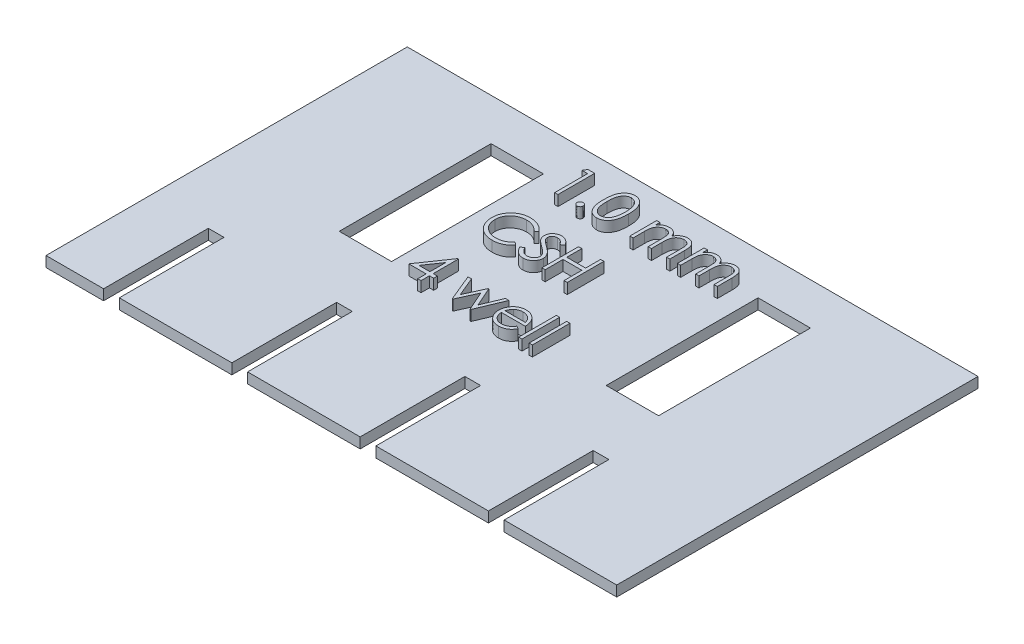
from build123d import *

# Parameters (mm, degrees)
SKETCH1_W           = 54.5
SKETCH1_H           = 34.5
BOSS_EXTRUDE1_DEPTH = 1
SKETCH6_W           = 5
SKETCH6_H           = 14.5
CUT_EXTRUDE1_DEPTH  = 2
SKETCH9_W           = 5
SKETCH9_H           = 14.5
CUT_EXTRUDE2_DEPTH  = 2
SKETCH27_W          = 1.5
SKETCH27_H          = 10
CUT_EXTRUDE3_DEPTH  = 2
WRAP1_OUTLINE_W     = 0.314102564
WRAP1_OUTLINE_H     = 3.58974359
WRAP1_DEPTH         = 1
SKETCH37_W          = 1.5
SKETCH37_H          = 10
CUT_EXTRUDE10_DEPTH = 2
SKETCH39_W          = 1.5
SKETCH39_H          = 10
CUT_EXTRUDE11_DEPTH = 2
SKETCH41_W          = 1.5
SKETCH41_H          = 10
CUT_EXTRUDE12_DEPTH = 2


# Read off the part's stored shape, not the designer's step: Wrap1
with BuildPart() as part:
    # Sketch1 → Boss-Extrude1 (new body)
    with BuildSketch(Plane(origin=(0, 0, 0), x_dir=(1, 0, 0), z_dir=(0, 1, 0))):
        Rectangle(SKETCH1_W, SKETCH1_H)
    extrude(amount=BOSS_EXTRUDE1_DEPTH)

    # Sketch6 → Cut-Extrude1 (cut)
    with BuildSketch(Plane(origin=(0, 1, 0), x_dir=(1, 0, 0), z_dir=(0, 1, 0))):
        with Locations((-12.75, 6)):
            Rectangle(SKETCH6_W, SKETCH6_H)
    extrude(amount=-CUT_EXTRUDE1_DEPTH, mode=Mode.SUBTRACT)

    # Sketch9 → Cut-Extrude2 (cut)
    with BuildSketch(Plane(origin=(0, 1, 0), x_dir=(1, 0, 0), z_dir=(0, 1, 0))):
        with Locations((12.75, 6)):
            Rectangle(SKETCH9_W, SKETCH9_H)
    extrude(amount=-CUT_EXTRUDE2_DEPTH, mode=Mode.SUBTRACT)

    # Sketch27 → Cut-Extrude3 (cut)
    with BuildSketch(Plane(origin=(0, 1, 0), x_dir=(1, 0, 0), z_dir=(0, 1, 0))):
        with Locations((-21, -12.25)):
            Rectangle(SKETCH27_W, SKETCH27_H)
    extrude(amount=-CUT_EXTRUDE3_DEPTH, mode=Mode.SUBTRACT)

    # Wrap1 outline → Wrap1 (add)
    # profile 1 of 13: a face of its own
    with BuildSketch(Plane(origin=(0, 1, 0), x_dir=(1, 0, 0), z_dir=(0, 1, 0))):
        with BuildLine():
            add(Edge.make_bspline(
                [(-4.694666055, 11.487214304), (-4.695861656, 11.467970974), (-4.698219363, 11.43002341), (-4.713481971, 11.374741948), (-4.742380021, 11.325115043), (-4.778615014, 11.279812905), (-4.823411448, 11.242872034), (-4.873513294, 11.21544869), (-4.928504552, 11.19875671), (-4.966820876, 11.196630413), (-4.986332722, 11.195547637)],
                knots=[0, 0, 0, 0, 0.126177718, 0.248820607, 0.371539969, 0.499983707, 0.627244198, 0.749225521, 0.87229795, 1, 1, 1, 1], degree=3))
            add(Edge.make_bspline(
                [(-4.986332722, 11.77888097), (-4.96684251, 11.777722804), (-4.928634227, 11.775452353), (-4.873395099, 11.759875679), (-4.823400439, 11.732217019), (-4.778868194, 11.695354241), (-4.742161718, 11.650658577), (-4.713517366, 11.601062669), (-4.698076381, 11.545361076), (-4.695822469, 11.506931401), (-4.694666055, 11.487214304)],
                knots=[0, 0, 0, 0, 0.127518927, 0.249985948, 0.371792352, 0.498870353, 0.625948354, 0.748491738, 0.870958759, 1, 1, 1, 1], degree=3))
            add(Edge.make_bspline(
                [(-5.277999388, 11.487214304), (-5.276937289, 11.506963683), (-5.274863671, 11.545521923), (-5.258088011, 11.600721031), (-5.230711799, 11.65088947), (-5.193706404, 11.69528605), (-5.149182108, 11.732473353), (-5.098885903, 11.759538146), (-5.043846362, 11.775578558), (-5.005836424, 11.777761075), (-4.986332722, 11.77888097)],
                knots=[0, 0, 0, 0, 0.129096958, 0.252045967, 0.373904964, 0.501037835, 0.628170706, 0.751376463, 0.872426013, 1, 1, 1, 1], degree=3))
            add(Edge.make_bspline(
                [(-4.986332722, 11.195547637), (-5.005858627, 11.196591234), (-5.04397831, 11.198628609), (-5.098764304, 11.215791415), (-5.149171273, 11.242614876), (-5.193958985, 11.279881785), (-5.230497456, 11.324881929), (-5.258122839, 11.375083725), (-5.274712988, 11.429865162), (-5.276894861, 11.467939805), (-5.277999388, 11.487214304)],
                knots=[0, 0, 0, 0, 0.127756603, 0.249414355, 0.372796476, 0.500111333, 0.628609941, 0.750643374, 0.873768379, 1, 1, 1, 1], degree=3))
        make_face()
    # profile 2 of 13: a face of its own
    with BuildSketch(Plane(origin=(0, 1, 0), x_dir=(1, 0, 0), z_dir=(0, 1, 0))):
        with BuildLine():
            add(Edge.make_bspline(
                [(-3.075775831, 14.830163022), (-3.047940352, 14.829675206), (-2.992584343, 14.828705095), (-2.910743968, 14.819381153), (-2.830794286, 14.80391003), (-2.753076148, 14.781989055), (-2.676951161, 14.754793379), (-2.603014754, 14.720706261), (-2.530807672, 14.681027394), (-2.461477384, 14.634403517), (-2.394262769, 14.582421241), (-2.330814806, 14.523658572), (-2.27112772, 14.458708853), (-2.214452415, 14.388266989), (-2.162396818, 14.310981904), (-2.112823385, 14.228197794), (-2.06845135, 14.138466929), (-2.025716674, 14.043286461), (-1.988829688, 13.940022803), (-1.955563442, 13.829258042), (-1.928684474, 13.709683855), (-1.906295201, 13.58192761), (-1.888950305, 13.445520127), (-1.876317663, 13.300753811), (-1.869644578, 13.147533421), (-1.868387877, 13.042775571), (-1.867742978, 12.989017188)],
                knots=[0, 0, 0, 0, 0.033788116, 0.067193932, 0.099862411, 0.132566612, 0.165151173, 0.197913187, 0.231319004, 0.265083278, 0.299255309, 0.334398567, 0.369942824, 0.406283561, 0.44406382, 0.482997707, 0.523354447, 0.56553659, 0.609612924, 0.656390811, 0.705885495, 0.7583245, 0.813831783, 0.872794559, 0.93472223, 1, 1, 1, 1], degree=3))
            add(Edge.make_bspline(
                [(-4.245948106, 12.989017188), (-4.245620088, 13.045114576), (-4.244982908, 13.15408456), (-4.237894487, 13.312869202), (-4.226119145, 13.461829491), (-4.209981772, 13.600972557), (-4.190343792, 13.730334322), (-4.164128305, 13.849569079), (-4.134315503, 13.959228686), (-4.099763057, 14.059670734), (-4.060775268, 14.152248437), (-4.018341007, 14.238673638), (-3.970776213, 14.318815571), (-3.9207993, 14.393953361), (-3.866387228, 14.462857056), (-3.809088438, 14.526499718), (-3.746666561, 14.583410469), (-3.681243553, 14.635256771), (-3.612227089, 14.680706243), (-3.541584423, 14.720738982), (-3.468829317, 14.754938849), (-3.393763134, 14.781829285), (-3.317060576, 14.804040131), (-3.238453509, 14.819229079), (-3.157812145, 14.828785988), (-3.103380711, 14.829699655), (-3.075775831, 14.830163022)],
                knots=[0, 0, 0, 0, 0.068594622, 0.133246042, 0.194312586, 0.251279223, 0.304513439, 0.354234907, 0.400480589, 0.443410755, 0.484014869, 0.523252301, 0.561042373, 0.597900239, 0.633518489, 0.668314351, 0.702495671, 0.736685354, 0.770293169, 0.803437255, 0.835912952, 0.868460246, 0.900846538, 0.933466525, 0.966257575, 1, 1, 1, 1], degree=3))
            add(Edge.make_bspline(
                [(-3.075775831, 11.150675842), (-3.103379945, 11.151142198), (-3.15780987, 11.152061759), (-3.238462295, 11.161575491), (-3.316744738, 11.176870994), (-3.393043492, 11.198287598), (-3.467750008, 11.224502435), (-3.539846294, 11.258656118), (-3.610133978, 11.297990187), (-3.678425534, 11.342785609), (-3.743437695, 11.394107292), (-3.8055363, 11.45087158), (-3.863161319, 11.514494992), (-3.916795415, 11.583972915), (-3.967769503, 11.658666157), (-4.014658876, 11.73959453), (-4.058029731, 11.826437141), (-4.097673221, 11.919755051), (-4.132821885, 12.020909979), (-4.163869593, 12.131059158), (-4.18838375, 12.251174794), (-4.209366706, 12.380292161), (-4.226291089, 12.518966091), (-4.237845414, 12.667271869), (-4.244986729, 12.825117078), (-4.245621799, 12.933386853), (-4.245948106, 12.989017188)],
                knots=[0, 0, 0, 0, 0.033787146, 0.066621658, 0.099284878, 0.131361165, 0.163585188, 0.196103927, 0.228902254, 0.262158056, 0.295991222, 0.330217846, 0.365059826, 0.400950737, 0.437620382, 0.475707529, 0.515380692, 0.556413541, 0.59976483, 0.646424156, 0.696431445, 0.749781518, 0.806573307, 0.867435532, 0.931886753, 1, 1, 1, 1], degree=3))
            add(Edge.make_bspline(
                [(-1.867742978, 12.989017188), (-1.868394563, 12.93549328), (-1.869664149, 12.831204128), (-1.876242855, 12.678673153), (-1.889201487, 12.53467511), (-1.905411475, 12.398864647), (-1.927862438, 12.271807029), (-1.955467604, 12.15306258), (-1.986117927, 12.042118508), (-2.023952721, 11.939883697), (-2.065363431, 11.844931974), (-2.110418628, 11.756264826), (-2.158688454, 11.673098533), (-2.211277199, 11.596098786), (-2.267330612, 11.524720129), (-2.328048401, 11.460222506), (-2.391718986, 11.401051834), (-2.459131402, 11.348400207), (-2.529542953, 11.302315402), (-2.60150203, 11.261101552), (-2.676285413, 11.227868857), (-2.752198366, 11.199333816), (-2.830326732, 11.177533364), (-2.910573123, 11.162459508), (-2.992529359, 11.15188766), (-3.047930924, 11.15108118), (-3.075775831, 11.150675842)],
                knots=[0, 0, 0, 0, 0.06506329, 0.126773166, 0.185515763, 0.240764679, 0.292979796, 0.342250373, 0.388919286, 0.432775664, 0.474628433, 0.514774691, 0.553605893, 0.591426406, 0.62802812, 0.663803634, 0.698984336, 0.733591489, 0.767628469, 0.801208348, 0.83426384, 0.866980695, 0.899719742, 0.932701912, 0.966175883, 1, 1, 1, 1], degree=3))
        make_face()
        with BuildLine():
            add(Edge.make_bspline(
                [(-3.065259004, 11.509650201), (-3.026501332, 11.511247982), (-2.949066009, 11.514440245), (-2.835932214, 11.545238982), (-2.726101944, 11.591708521), (-2.640030004, 11.646656027), (-2.57454746, 11.698984356), (-2.52763047, 11.743599005), (-2.484568421, 11.793554872), (-2.443726347, 11.847454168), (-2.406267271, 11.906326652), (-2.372204133, 11.969889227), (-2.341120786, 12.038318405), (-2.32341174, 12.086088144), (-2.314357562, 12.110511579)],
                knots=[0, 0, 0, 0, 0.112813401, 0.225393884, 0.339594815, 0.45967541, 0.52173519, 0.583925839, 0.648174145, 0.713881038, 0.781004455, 0.851450928, 0.924050693, 1, 1, 1, 1], degree=3))
            add(Edge.make_bspline(
                [(-3.931845542, 12.990419432), (-3.931726095, 12.943670733), (-3.931494272, 12.852940688), (-3.925438071, 12.721097427), (-3.917187839, 12.598127098), (-3.906546542, 12.483873562), (-3.890743594, 12.378723549), (-3.873036806, 12.281953866), (-3.851488716, 12.194076629), (-3.825993698, 12.114488819), (-3.796954601, 12.04183975), (-3.765248738, 11.974238535), (-3.731188015, 11.910886598), (-3.693068864, 11.85235299), (-3.651553801, 11.798446826), (-3.607580542, 11.748213994), (-3.559507958, 11.703417012), (-3.493004215, 11.649690157), (-3.405207741, 11.594171024), (-3.294587286, 11.545824934), (-3.180918835, 11.515442477), (-3.103767584, 11.511578721), (-3.065259004, 11.509650201)],
                knots=[0, 0, 0, 0, 0.072951066, 0.141583694, 0.20592646, 0.265301357, 0.320597233, 0.371816503, 0.41878977, 0.461698729, 0.502133582, 0.540804315, 0.578180525, 0.614296865, 0.649678243, 0.68429946, 0.718358953, 0.752080865, 0.817652439, 0.879722076, 0.93996556, 1, 1, 1, 1], degree=3))
            add(Edge.make_bspline(
                [(-3.065259004, 14.471188663), (-3.103969596, 14.469157216), (-3.181461302, 14.465090622), (-3.295909256, 14.436397368), (-3.405613608, 14.386384402), (-3.492856583, 14.33143203), (-3.559720369, 14.279093718), (-3.606803062, 14.233707264), (-3.650949235, 14.18406101), (-3.691616935, 14.129659095), (-3.729706218, 14.071193728), (-3.764687231, 14.008204963), (-3.79620456, 13.940373599), (-3.825289096, 13.867757163), (-3.850861884, 13.788176219), (-3.871955848, 13.700407225), (-3.891442901, 13.603945334), (-3.90523817, 13.498225826), (-3.917501926, 13.383943672), (-3.925383273, 13.260666354), (-3.931514531, 13.128601974), (-3.931732995, 13.037402815), (-3.931845542, 12.990419432)],
                knots=[0, 0, 0, 0, 0.060386619, 0.120883249, 0.182754619, 0.24781103, 0.2812991, 0.315087624, 0.349702396, 0.384856581, 0.420966197, 0.458511188, 0.497174722, 0.537602048, 0.580503018, 0.62746754, 0.67838821, 0.733983221, 0.793746705, 0.857713672, 0.926697864, 1, 1, 1, 1], degree=3))
            add(Edge.make_bspline(
                [(-2.181845542, 12.990419432), (-2.182395732, 13.032487004), (-2.183472019, 13.114780169), (-2.187586007, 13.23529835), (-2.198209582, 13.349766111), (-2.2100087, 13.458676583), (-2.227405921, 13.561426886), (-2.246163728, 13.658877191), (-2.271364941, 13.749820216), (-2.298284716, 13.835679798), (-2.329095111, 13.915480452), (-2.363010845, 13.989594239), (-2.399232604, 14.058378963), (-2.438574845, 14.121645905), (-2.480570528, 14.179678448), (-2.526328077, 14.231313042), (-2.57403245, 14.278150011), (-2.640849636, 14.33161258), (-2.728323925, 14.386124275), (-2.837169573, 14.436290035), (-2.950440217, 14.465098328), (-3.027013671, 14.469160015), (-3.065259004, 14.471188663)],
                knots=[0, 0, 0, 0, 0.065681198, 0.128486464, 0.18817513, 0.245106131, 0.299448425, 0.350822936, 0.399941681, 0.446671744, 0.491254533, 0.533376344, 0.573852755, 0.612526312, 0.649597136, 0.685532042, 0.720105786, 0.753837663, 0.818925416, 0.880493462, 0.940311334, 1, 1, 1, 1], degree=3))
            add(Edge.make_bspline(
                [(-2.314357562, 12.110511579), (-2.303805794, 12.141741319), (-2.28238118, 12.205151083), (-2.254769406, 12.303514735), (-2.233024006, 12.406717499), (-2.213460641, 12.514142616), (-2.200107585, 12.626582317), (-2.189359772, 12.743688701), (-2.183029085, 12.865550063), (-2.182244334, 12.948345054), (-2.181845542, 12.990419432)],
                knots=[0, 0, 0, 0, 0.110588339, 0.224541754, 0.342503494, 0.464324098, 0.590756033, 0.722227475, 0.858842836, 1, 1, 1, 1], degree=3))
        make_face(mode=Mode.SUBTRACT)
    # profile 3 of 13: a face of its own
    with BuildSketch(Plane(origin=(0, 1, 0), x_dir=(1, 0, 0), z_dir=(0, 1, 0))):
        with BuildLine():
            add(Edge.make_bspline(
                [(0.33097497, 13.353600522), (0.35925892, 13.392488123), (0.41345368, 13.467000496), (0.502319333, 13.565190781), (0.591095445, 13.648518935), (0.655028827, 13.692261807), (0.685742599, 13.713276002)],
                knots=[0, 0, 0, 0, 0.283594808, 0.543394841, 0.780645629, 1, 1, 1, 1], degree=3))
            Line((0.33097497, 13.353600522), (0.33097497, 13.79811174))
            Line((0.33097497, 13.79811174), (0.016872406, 13.79811174))
            Line((0.016872406, 13.79811174), (0.016872406, 11.240419432))
            Line((0.016872406, 11.240419432), (0.33097497, 11.240419432))
            Line((0.33097497, 11.240419432), (0.33097497, 12.316641387))
            add(Edge.make_bspline(
                [(1.158298688, 13.52888097), (1.120282477, 13.52735051), (1.044517518, 13.524300358), (0.933215548, 13.496846084), (0.825729864, 13.453842009), (0.723775166, 13.39418219), (0.630101017, 13.320283111), (0.54809275, 13.233368216), (0.479150224, 13.134519182), (0.433418409, 13.042354666), (0.403919935, 12.960781391), (0.384324601, 12.891430443), (0.367484975, 12.814430195), (0.354970953, 12.729543084), (0.342890538, 12.63732199), (0.337060228, 12.5373075), (0.331388666, 12.429585412), (0.331116252, 12.355212867), (0.33097497, 12.316641387)],
                knots=[0, 0, 0, 0, 0.068677068, 0.136870959, 0.206114357, 0.277538182, 0.349771978, 0.421250836, 0.492910757, 0.567026589, 0.606614153, 0.649703954, 0.69730315, 0.74908566, 0.804880647, 0.865485006, 0.930237127, 1, 1, 1, 1], degree=3))
            add(Edge.make_bspline(
                [(1.766872406, 12.541000361), (1.766792975, 12.57769368), (1.766640158, 12.648287937), (1.763963841, 12.749521613), (1.758877219, 12.841602693), (1.752996671, 12.924424156), (1.744536492, 12.997835485), (1.73492673, 13.062230243), (1.72357812, 13.117446994), (1.704788235, 13.178010379), (1.676073767, 13.244731302), (1.629885505, 13.315872323), (1.572277924, 13.378140421), (1.504707049, 13.431299169), (1.428701366, 13.475240651), (1.344717966, 13.506900402), (1.253513053, 13.525324692), (1.190635347, 13.527673189), (1.158298688, 13.52888097)],
                knots=[0, 0, 0, 0, 0.082529704, 0.158778855, 0.227738062, 0.289945653, 0.345498839, 0.393896337, 0.436373785, 0.472122274, 0.536383616, 0.599077902, 0.661948234, 0.726310542, 0.791771103, 0.858647304, 0.927305334, 1, 1, 1, 1], degree=3))
            Line((1.766872406, 12.541000361), (1.766872406, 11.240419432))
            Line((1.766872406, 11.240419432), (2.08097497, 11.240419432))
            Line((2.08097497, 11.240419432), (2.08097497, 12.235311259))
            add(Edge.make_bspline(
                [(2.910402054, 13.52888097), (2.870732099, 13.527464813), (2.792329188, 13.524665948), (2.677883702, 13.496092075), (2.567912685, 13.453011824), (2.465697553, 13.390579367), (2.371669762, 13.315771003), (2.290770184, 13.226821407), (2.223937998, 13.12619148), (2.178684023, 13.033044778), (2.150094721, 12.949375334), (2.131217806, 12.876277962), (2.116534414, 12.793196394), (2.102763885, 12.700688903), (2.093776157, 12.598118723), (2.085607785, 12.485960322), (2.081786922, 12.363876363), (2.081252463, 12.279249674), (2.08097497, 12.235311259)],
                knots=[0, 0, 0, 0, 0.068158244, 0.134706602, 0.201864998, 0.270788266, 0.340024294, 0.408082739, 0.476813195, 0.547346064, 0.585639795, 0.628864953, 0.677153203, 0.730802811, 0.789806616, 0.854325009, 0.924365134, 1, 1, 1, 1], degree=3))
            add(Edge.make_bspline(
                [(3.516872406, 12.627238342), (3.516794523, 12.659958916), (3.516644844, 12.722842883), (3.513951213, 12.813095334), (3.508875899, 12.895363691), (3.50294126, 12.969535779), (3.49469745, 13.035784568), (3.484051519, 13.093976987), (3.472773839, 13.144570798), (3.454037848, 13.200656845), (3.424089956, 13.262527056), (3.378472476, 13.329250632), (3.32100237, 13.387331432), (3.254642213, 13.437749749), (3.179093768, 13.47874339), (3.095829045, 13.5080194), (3.005364994, 13.526142278), (2.942742205, 13.527948294), (2.910402054, 13.52888097)],
                knots=[0, 0, 0, 0, 0.078342985, 0.150563303, 0.216151057, 0.275679792, 0.32870705, 0.375904435, 0.417301898, 0.452692748, 0.517265292, 0.581216568, 0.645321894, 0.712024493, 0.780130045, 0.850218226, 0.922648522, 1, 1, 1, 1], degree=3))
            Line((3.516872406, 12.627238342), (3.516872406, 11.240419432))
            Line((3.516872406, 11.240419432), (3.83097497, 11.240419432))
            Line((3.83097497, 11.240419432), (3.83097497, 12.625836098))
            add(Edge.make_bspline(
                [(2.965089554, 13.842983534), (3.007971017, 13.841366314), (3.091894203, 13.838201255), (3.214071469, 13.813347782), (3.328013274, 13.770670135), (3.43349035, 13.712436498), (3.528650163, 13.639257315), (3.611366473, 13.552188477), (3.681136836, 13.451845854), (3.726715476, 13.357453866), (3.75763074, 13.274118533), (3.776691974, 13.203112241), (3.793531669, 13.124960689), (3.807512915, 13.039570427), (3.817731467, 12.946639819), (3.825302182, 12.846320943), (3.830426256, 12.738535831), (3.830788328, 12.664170331), (3.83097497, 12.625836098)],
                knots=[0, 0, 0, 0, 0.07560433, 0.147965015, 0.218796999, 0.289470445, 0.359724218, 0.429707739, 0.50049652, 0.57442902, 0.613947296, 0.65715527, 0.70397277, 0.754938985, 0.809706611, 0.868832954, 0.932385474, 1, 1, 1, 1], degree=3))
            add(Edge.make_bspline(
                [(2.026988592, 13.225295233), (2.040699844, 13.250019652), (2.067681661, 13.298673837), (2.112987298, 13.3675321), (2.160455094, 13.431938891), (2.210489587, 13.491945316), (2.262914174, 13.547255046), (2.317975575, 13.598050948), (2.375360356, 13.644551162), (2.455152596, 13.698874321), (2.558965203, 13.756575502), (2.689853318, 13.806603946), (2.82600349, 13.837520075), (2.918421188, 13.841150348), (2.965089554, 13.842983534)],
                knots=[0, 0, 0, 0, 0.071766064, 0.141225536, 0.209115852, 0.274839653, 0.33948293, 0.402476267, 0.464941889, 0.526832641, 0.647414816, 0.765561512, 0.881615087, 1, 1, 1, 1], degree=3))
            add(Edge.make_bspline(
                [(1.212986188, 13.842983534), (1.243879185, 13.841938244), (1.305014764, 13.839869669), (1.395598854, 13.826409634), (1.483457466, 13.803143461), (1.568071495, 13.770736137), (1.647792175, 13.73148945), (1.720881372, 13.685439742), (1.786505581, 13.633742667), (1.844631632, 13.574063734), (1.896900657, 13.504727135), (1.944979504, 13.423862887), (1.989404716, 13.329655225), (2.014026025, 13.261288685), (2.026988592, 13.225295233)],
                knots=[0, 0, 0, 0, 0.084152019, 0.16653232, 0.248836331, 0.331246145, 0.412957109, 0.490494278, 0.566155792, 0.639987335, 0.716765488, 0.802143905, 0.895833201, 1, 1, 1, 1], degree=3))
            add(Edge.make_bspline(
                [(0.685742599, 13.713276002), (0.727607261, 13.733281368), (0.810605161, 13.772942581), (0.942024386, 13.81317614), (1.076499055, 13.837901241), (1.167307269, 13.841282615), (1.212986188, 13.842983534)],
                knots=[0, 0, 0, 0, 0.253734076, 0.50303512, 0.750013597, 1, 1, 1, 1], degree=3))
        make_face()
    # profile 4 of 13: a face of its own
    with BuildSketch(Plane(origin=(0, 1, 0), x_dir=(1, 0, 0), z_dir=(0, 1, 0))):
        with BuildLine():
            add(Edge.make_bspline(
                [(4.863026253, 13.353600522), (4.891310202, 13.392488123), (4.945504962, 13.467000496), (5.034370615, 13.565190781), (5.123146727, 13.648518935), (5.187080109, 13.692261807), (5.217793881, 13.713276002)],
                knots=[0, 0, 0, 0, 0.283594808, 0.543394841, 0.780645629, 1, 1, 1, 1], degree=3))
            Line((4.863026253, 13.353600522), (4.863026253, 13.79811174))
            Line((4.863026253, 13.79811174), (4.548923688, 13.79811174))
            Line((4.548923688, 13.79811174), (4.548923688, 11.240419432))
            Line((4.548923688, 11.240419432), (4.863026253, 11.240419432))
            Line((4.863026253, 11.240419432), (4.863026253, 12.316641387))
            add(Edge.make_bspline(
                [(5.69034997, 13.52888097), (5.652333759, 13.52735051), (5.5765688, 13.524300358), (5.46526683, 13.496846084), (5.357781146, 13.453842009), (5.255826448, 13.39418219), (5.162152299, 13.320283111), (5.080144032, 13.233368216), (5.011201506, 13.134519182), (4.965469692, 13.042354666), (4.935971217, 12.960781391), (4.916375883, 12.891430443), (4.899536257, 12.814430195), (4.887022235, 12.729543084), (4.87494182, 12.63732199), (4.869111511, 12.5373075), (4.863439948, 12.429585412), (4.863167534, 12.355212867), (4.863026253, 12.316641387)],
                knots=[0, 0, 0, 0, 0.068677068, 0.136870959, 0.206114357, 0.277538182, 0.349771978, 0.421250836, 0.492910757, 0.567026589, 0.606614153, 0.649703954, 0.69730315, 0.74908566, 0.804880647, 0.865485006, 0.930237127, 1, 1, 1, 1], degree=3))
            add(Edge.make_bspline(
                [(6.298923688, 12.541000361), (6.298844257, 12.57769368), (6.29869144, 12.648287937), (6.296015123, 12.749521613), (6.290928501, 12.841602693), (6.285047953, 12.924424156), (6.276587774, 12.997835485), (6.266978012, 13.062230243), (6.255629402, 13.117446994), (6.236839517, 13.178010379), (6.208125049, 13.244731302), (6.161936787, 13.315872323), (6.104329206, 13.378140421), (6.036758331, 13.431299169), (5.960752648, 13.475240651), (5.876769248, 13.506900402), (5.785564335, 13.525324692), (5.722686629, 13.527673189), (5.69034997, 13.52888097)],
                knots=[0, 0, 0, 0, 0.082529704, 0.158778855, 0.227738062, 0.289945653, 0.345498839, 0.393896337, 0.436373785, 0.472122274, 0.536383616, 0.599077902, 0.661948234, 0.726310542, 0.791771103, 0.858647304, 0.927305334, 1, 1, 1, 1], degree=3))
            Line((6.298923688, 12.541000361), (6.298923688, 11.240419432))
            Line((6.298923688, 11.240419432), (6.613026253, 11.240419432))
            Line((6.613026253, 11.240419432), (6.613026253, 12.235311259))
            add(Edge.make_bspline(
                [(7.442453336, 13.52888097), (7.402783382, 13.527464813), (7.32438047, 13.524665948), (7.209934984, 13.496092075), (7.099963968, 13.453011824), (6.997748835, 13.390579367), (6.903721044, 13.315771003), (6.822821466, 13.226821407), (6.755989281, 13.12619148), (6.710735305, 13.033044778), (6.682146003, 12.949375334), (6.663269088, 12.876277962), (6.648585696, 12.793196394), (6.634815167, 12.700688903), (6.625827439, 12.598118723), (6.617659067, 12.485960322), (6.613838204, 12.363876363), (6.613303745, 12.279249674), (6.613026253, 12.235311259)],
                knots=[0, 0, 0, 0, 0.068158244, 0.134706602, 0.201864998, 0.270788266, 0.340024294, 0.408082739, 0.476813195, 0.547346064, 0.585639795, 0.628864953, 0.677153203, 0.730802811, 0.789806616, 0.854325009, 0.924365134, 1, 1, 1, 1], degree=3))
            add(Edge.make_bspline(
                [(8.048923688, 12.627238342), (8.048845805, 12.659958916), (8.048696126, 12.722842883), (8.046002495, 12.813095334), (8.040927181, 12.895363691), (8.034992542, 12.969535779), (8.026748732, 13.035784568), (8.016102801, 13.093976987), (8.004825121, 13.144570798), (7.98608913, 13.200656845), (7.956141238, 13.262527056), (7.910523758, 13.329250632), (7.853053652, 13.387331432), (7.786693495, 13.437749749), (7.711145051, 13.47874339), (7.627880327, 13.5080194), (7.537416276, 13.526142278), (7.474793487, 13.527948294), (7.442453336, 13.52888097)],
                knots=[0, 0, 0, 0, 0.078342985, 0.150563303, 0.216151057, 0.275679792, 0.32870705, 0.375904435, 0.417301898, 0.452692748, 0.517265292, 0.581216568, 0.645321894, 0.712024493, 0.780130045, 0.850218226, 0.922648522, 1, 1, 1, 1], degree=3))
            Line((8.048923688, 12.627238342), (8.048923688, 11.240419432))
            Line((8.048923688, 11.240419432), (8.363026253, 11.240419432))
            Line((8.363026253, 11.240419432), (8.363026253, 12.625836098))
            add(Edge.make_bspline(
                [(7.497140836, 13.842983534), (7.540022299, 13.841366314), (7.623945485, 13.838201255), (7.746122751, 13.813347782), (7.860064556, 13.770670135), (7.965541632, 13.712436498), (8.060701446, 13.639257315), (8.143417755, 13.552188477), (8.213188118, 13.451845854), (8.258766758, 13.357453866), (8.289682022, 13.274118533), (8.308743256, 13.203112241), (8.325582951, 13.124960689), (8.339564197, 13.039570427), (8.349782749, 12.946639819), (8.357353464, 12.846320943), (8.362477538, 12.738535831), (8.36283961, 12.664170331), (8.363026253, 12.625836098)],
                knots=[0, 0, 0, 0, 0.07560433, 0.147965015, 0.218796999, 0.289470445, 0.359724218, 0.429707739, 0.50049652, 0.57442902, 0.613947296, 0.65715527, 0.70397277, 0.754938985, 0.809706611, 0.868832954, 0.932385474, 1, 1, 1, 1], degree=3))
            add(Edge.make_bspline(
                [(6.559039874, 13.225295233), (6.572751126, 13.250019652), (6.599732943, 13.298673837), (6.64503858, 13.3675321), (6.692506376, 13.431938891), (6.742540869, 13.491945316), (6.794965456, 13.547255046), (6.850026857, 13.598050948), (6.907411638, 13.644551162), (6.987203878, 13.698874321), (7.091016485, 13.756575502), (7.2219046, 13.806603946), (7.358054772, 13.837520075), (7.45047247, 13.841150348), (7.497140836, 13.842983534)],
                knots=[0, 0, 0, 0, 0.071766064, 0.141225536, 0.209115852, 0.274839653, 0.33948293, 0.402476267, 0.464941889, 0.526832641, 0.647414816, 0.765561512, 0.881615087, 1, 1, 1, 1], degree=3))
            add(Edge.make_bspline(
                [(5.74503747, 13.842983534), (5.775930467, 13.841938244), (5.837066046, 13.839869669), (5.927650136, 13.826409634), (6.015508748, 13.803143461), (6.100122777, 13.770736137), (6.179843457, 13.73148945), (6.252932654, 13.685439742), (6.318556863, 13.633742667), (6.376682914, 13.574063734), (6.428951939, 13.504727135), (6.477030786, 13.423862887), (6.521455998, 13.329655225), (6.546077307, 13.261288685), (6.559039874, 13.225295233)],
                knots=[0, 0, 0, 0, 0.084152019, 0.16653232, 0.248836331, 0.331246145, 0.412957109, 0.490494278, 0.566155792, 0.639987335, 0.716765488, 0.802143905, 0.895833201, 1, 1, 1, 1], degree=3))
            add(Edge.make_bspline(
                [(5.217793881, 13.713276002), (5.259658543, 13.733281368), (5.342656443, 13.772942581), (5.474075668, 13.81317614), (5.608550337, 13.837901241), (5.699358551, 13.841282615), (5.74503747, 13.842983534)],
                knots=[0, 0, 0, 0, 0.253734076, 0.50303512, 0.750013597, 1, 1, 1, 1], degree=3))
        make_face()
    # profile 5 of 13: a face of its own
    with BuildSketch(Plane(origin=(0, 1, 0), x_dir=(1, 0, 0), z_dir=(0, 1, 0))):
        with BuildLine():
            add(Edge.make_bspline(
                [(-4.969505799, 7.054521996), (-4.989111687, 7.077887966), (-5.028059134, 7.124304881), (-5.090718336, 7.189484426), (-5.156019979, 7.250549687), (-5.223939101, 7.307791567), (-5.29569822, 7.359208333), (-5.369559019, 7.407479436), (-5.446757064, 7.450747174), (-5.553508799, 7.50321016), (-5.693156647, 7.557956315), (-5.868951486, 7.603859546), (-6.052462584, 7.633080722), (-6.177660184, 7.636245563), (-6.241340735, 7.637855329)],
                knots=[0, 0, 0, 0, 0.063163259, 0.125474941, 0.18712122, 0.248294346, 0.309294856, 0.369850066, 0.430973376, 0.49245599, 0.616147966, 0.740843698, 0.868182649, 1, 1, 1, 1], degree=3))
            Line((-4.969505799, 7.054521996), (-4.694666055, 7.264858534))
            add(Edge.make_bspline(
                [(-6.221709324, 7.996829688), (-6.181494852, 7.99634755), (-6.101894355, 7.995393206), (-5.984141703, 7.986087064), (-5.869499376, 7.970573458), (-5.757888394, 7.949457388), (-5.648765778, 7.923250066), (-5.542965537, 7.889109768), (-5.43986685, 7.850073237), (-5.340119942, 7.805114771), (-5.244203391, 7.754648029), (-5.152147073, 7.699232406), (-5.064682214, 7.6389366), (-4.981193366, 7.574273425), (-4.903077155, 7.503874866), (-4.828115676, 7.42967727), (-4.758854598, 7.349543446), (-4.716101403, 7.293138512), (-4.694666055, 7.264858534)],
                knots=[0, 0, 0, 0, 0.068547537, 0.135682946, 0.20121499, 0.265682235, 0.329266835, 0.392395428, 0.455069762, 0.51712685, 0.578790035, 0.639739863, 0.700191504, 0.759806243, 0.819628319, 0.879354791, 0.939511608, 1, 1, 1, 1], degree=3))
            add(Edge.make_bspline(
                [(-8.104922465, 6.177418631), (-8.103367272, 6.240374084), (-8.100307526, 6.364235009), (-8.07431173, 6.546008962), (-8.032492934, 6.720160361), (-7.973096045, 6.886364105), (-7.897790694, 7.045494386), (-7.80476408, 7.19633559), (-7.695096938, 7.33985239), (-7.56964937, 7.473867141), (-7.432082035, 7.596406494), (-7.284763221, 7.704212698), (-7.127981274, 7.793930214), (-6.963463422, 7.868926376), (-6.789977741, 7.926570839), (-6.607894372, 7.966924026), (-6.417555457, 7.992041142), (-6.287693031, 7.99521635), (-6.221709324, 7.996829688)],
                knots=[0, 0, 0, 0, 0.064557846, 0.127013532, 0.18795481, 0.248013913, 0.307747682, 0.368234515, 0.429469844, 0.492743437, 0.556257769, 0.618216786, 0.679655476, 0.741245546, 0.803415265, 0.866815462, 0.932328312, 1, 1, 1, 1], degree=3))
            add(Edge.make_bspline(
                [(-7.661112369, 4.929421836), (-7.696548013, 4.972963025), (-7.76699149, 5.059519735), (-7.857117173, 5.199805716), (-7.934264728, 5.346273925), (-7.996640649, 5.499693854), (-8.045403382, 5.659721241), (-8.079184577, 5.826436756), (-8.101136182, 5.999684698), (-8.103646471, 6.117521486), (-8.104922465, 6.177418631)],
                knots=[0, 0, 0, 0, 0.12432851, 0.247156016, 0.368779749, 0.490733862, 0.613613772, 0.738957576, 0.867310575, 1, 1, 1, 1], degree=3))
            add(Edge.make_bspline(
                [(-6.217502594, 4.317342509), (-6.255146261, 4.317604501), (-6.329581951, 4.318122559), (-6.439480702, 4.326514727), (-6.546470283, 4.337964463), (-6.650244909, 4.355204595), (-6.751370884, 4.375548935), (-6.848931469, 4.402820191), (-6.943886679, 4.433369358), (-7.03585502, 4.469274345), (-7.124914719, 4.509790527), (-7.210778531, 4.555582086), (-7.293406963, 4.606263951), (-7.373612384, 4.660718961), (-7.450209968, 4.720696263), (-7.523863493, 4.785362897), (-7.594985969, 4.854500908), (-7.638988654, 4.904355762), (-7.661112369, 4.929421836)],
                knots=[0, 0, 0, 0, 0.069662801, 0.137749562, 0.203916744, 0.268779862, 0.332413706, 0.39475354, 0.456180032, 0.516995649, 0.577395938, 0.637198344, 0.696999184, 0.756756194, 0.816553905, 0.876947997, 0.938131788, 1, 1, 1, 1], degree=3))
            add(Edge.make_bspline(
                [(-4.694666055, 5.051417028), (-4.716784165, 5.022878576), (-4.76091444, 4.96593837), (-4.832372457, 4.88566666), (-4.907649755, 4.810162625), (-4.987305465, 4.740035003), (-5.070423256, 4.673880538), (-5.158495569, 4.613578706), (-5.250364601, 4.558287822), (-5.34571908, 4.507660898), (-5.444457693, 4.462743651), (-5.546462128, 4.424289883), (-5.651292703, 4.391164993), (-5.758954212, 4.363913057), (-5.869669969, 4.342641973), (-5.983040443, 4.328422298), (-6.099310318, 4.318680383), (-6.177751739, 4.317792468), (-6.217502594, 4.317342509)],
                knots=[0, 0, 0, 0, 0.061674239, 0.123053062, 0.183475001, 0.243726501, 0.304278917, 0.364862921, 0.425946204, 0.48739123, 0.549220384, 0.611143589, 0.67352853, 0.736961457, 0.800785283, 0.866012596, 0.932100748, 1, 1, 1, 1], degree=3))
            Line((-4.694666055, 5.051417028), (-4.969505799, 5.259650201))
            add(Edge.make_bspline(
                [(-6.219605959, 4.676316868), (-6.15850327, 4.678005647), (-6.038238561, 4.68132957), (-5.861870535, 4.709488819), (-5.693034769, 4.755146737), (-5.531722183, 4.819044659), (-5.378387536, 4.902109947), (-5.232790876, 5.002807825), (-5.094809306, 5.122096157), (-5.011838023, 5.213179286), (-4.969505799, 5.259650201)],
                knots=[0, 0, 0, 0, 0.12851519, 0.252948636, 0.374754734, 0.495939754, 0.617180641, 0.740909469, 0.867811148, 1, 1, 1, 1], degree=3))
            add(Edge.make_bspline(
                [(-7.790819901, 6.15358049), (-7.789558082, 6.10184917), (-7.787080668, 6.000281585), (-7.765032334, 5.851510974), (-7.731527243, 5.7089903), (-7.681311666, 5.573610458), (-7.619392615, 5.4437021), (-7.541152004, 5.321463247), (-7.450535466, 5.205046682), (-7.346261047, 5.097203734), (-7.231855231, 4.998690009), (-7.109107319, 4.911939428), (-6.978323031, 4.839624545), (-6.840946401, 4.779448599), (-6.695920287, 4.733191871), (-6.543505485, 4.700627747), (-6.38403349, 4.679385567), (-6.27506409, 4.677351879), (-6.219605959, 4.676316868)],
                knots=[0, 0, 0, 0, 0.064323217, 0.126290104, 0.186726469, 0.246146432, 0.305575643, 0.365429386, 0.426326309, 0.488839906, 0.551724972, 0.613918596, 0.675483766, 0.737333897, 0.800229044, 0.864502298, 0.931040739, 1, 1, 1, 1], degree=3))
            add(Edge.make_bspline(
                [(-6.241340735, 7.637855329), (-6.276424034, 7.637451367), (-6.346265027, 7.636647191), (-6.4499135, 7.626038066), (-6.551626551, 7.611126856), (-6.651338017, 7.589001532), (-6.748920976, 7.561028913), (-6.845013378, 7.527603499), (-6.938223978, 7.48624866), (-7.029842216, 7.4405404), (-7.117621427, 7.388912955), (-7.200676475, 7.332599603), (-7.278704443, 7.272230507), (-7.351767055, 7.2075794), (-7.419939003, 7.13893744), (-7.482726314, 7.065573098), (-7.539911724, 6.987720925), (-7.592628749, 6.906407517), (-7.639841483, 6.821869725), (-7.679371362, 6.733794655), (-7.714376484, 6.643690552), (-7.742075727, 6.550539391), (-7.764000244, 6.454996625), (-7.779127907, 6.356805837), (-7.789616378, 6.256172158), (-7.790416555, 6.187962845), (-7.790819901, 6.15358049)],
                knots=[0, 0, 0, 0, 0.043954909, 0.087501875, 0.130462627, 0.172752021, 0.215403067, 0.25764983, 0.300152749, 0.34312149, 0.385925163, 0.427685727, 0.46881795, 0.5094918, 0.549883031, 0.589980023, 0.63040523, 0.670868626, 0.711383944, 0.751627258, 0.791775577, 0.832458919, 0.873319045, 0.914542956, 0.956923558, 1, 1, 1, 1], degree=3))
        make_face()
    # profile 6 of 13: a face of its own
    with BuildSketch(Plane(origin=(0, 1, 0), x_dir=(1, 0, 0), z_dir=(0, 1, 0))):
        with BuildLine():
            add(Edge.make_bspline(
                [(-4.039818299, 5.259650201), (-4.012300061, 5.213585816), (-3.959576181, 5.125328232), (-3.871624822, 5.006070192), (-3.780491911, 4.904708035), (-3.685502577, 4.821831427), (-3.587236629, 4.756582541), (-3.485052575, 4.710380309), (-3.379294764, 4.681564334), (-3.307320943, 4.678064247), (-3.271388812, 4.676316868)],
                knots=[0, 0, 0, 0, 0.159004299, 0.3046461, 0.438546905, 0.562322299, 0.677432543, 0.786897393, 0.893610889, 1, 1, 1, 1], degree=3))
            Line((-4.039818299, 5.259650201), (-4.335691696, 5.082266387))
            add(Edge.make_bspline(
                [(-3.271388812, 4.317342509), (-3.297824155, 4.31785369), (-3.350361915, 4.318869616), (-3.428071396, 4.327850896), (-3.504210986, 4.340558), (-3.577825268, 4.36073207), (-3.649862679, 4.385209047), (-3.720009914, 4.415347379), (-3.788300968, 4.451464581), (-3.855118551, 4.492759605), (-3.920292725, 4.54081735), (-3.983212193, 4.596790846), (-4.045941379, 4.659136351), (-4.106628775, 4.729546915), (-4.166501919, 4.806884998), (-4.224380329, 4.891874181), (-4.281462046, 4.984051535), (-4.317277514, 5.048916621), (-4.335691696, 5.082266387)],
                knots=[0, 0, 0, 0, 0.057208269, 0.11369606, 0.169177916, 0.224159217, 0.278719878, 0.333794217, 0.389241459, 0.445822073, 0.503704281, 0.564293892, 0.627975416, 0.69503826, 0.765372726, 0.839611443, 0.91753775, 1, 1, 1, 1], degree=3))
            add(Edge.make_bspline(
                [(-2.271589132, 5.264558054), (-2.27224627, 5.233179689), (-2.273547785, 5.171032305), (-2.288508699, 5.079777228), (-2.310428364, 4.991146358), (-2.343465598, 4.906235246), (-2.383788756, 4.823490483), (-2.434955004, 4.745082583), (-2.494262689, 4.669276184), (-2.562296454, 4.598092693), (-2.636742356, 4.532746497), (-2.715426051, 4.474617435), (-2.798476324, 4.426149112), (-2.885442641, 4.38659827), (-2.976344977, 4.355664752), (-3.071152761, 4.333251883), (-3.170022272, 4.319496172), (-3.237222754, 4.318068411), (-3.271388812, 4.317342509)],
                knots=[0, 0, 0, 0, 0.061484255, 0.121774528, 0.18091956, 0.240256115, 0.300114444, 0.361145948, 0.423500582, 0.488669361, 0.553954105, 0.617581261, 0.680238427, 0.742187389, 0.804663212, 0.868258989, 0.933020257, 1, 1, 1, 1], degree=3))
            add(Edge.make_bspline(
                [(-3.096108363, 6.394065265), (-3.05812245, 6.366423906), (-2.984567993, 6.312900244), (-2.879910413, 6.232484564), (-2.785016605, 6.153836795), (-2.699553402, 6.077459188), (-2.622676493, 6.003931095), (-2.555238772, 5.932367915), (-2.496553092, 5.863282342), (-2.433373874, 5.774709766), (-2.368816054, 5.665928682), (-2.313374547, 5.532650444), (-2.278416199, 5.398854123), (-2.273844684, 5.308927287), (-2.271589132, 5.264558054)],
                knots=[0, 0, 0, 0, 0.09697231, 0.187773439, 0.272396139, 0.351320997, 0.424334774, 0.491908784, 0.55423322, 0.611267658, 0.716347845, 0.814540086, 0.908495456, 1, 1, 1, 1], degree=3))
            add(Edge.make_bspline(
                [(-3.566561087, 6.742522797), (-3.558899715, 6.735685771), (-3.540698048, 6.719442563), (-3.507422122, 6.692850282), (-3.463479324, 6.66004751), (-3.410017123, 6.619460194), (-3.346049761, 6.572378732), (-3.271570205, 6.519405119), (-3.187408672, 6.45881966), (-3.127686756, 6.41646212), (-3.096108363, 6.394065265)],
                knots=[0, 0, 0, 0, 0.052594282, 0.124951974, 0.218093899, 0.333502411, 0.468789179, 0.624937586, 0.801683048, 1, 1, 1, 1], degree=3))
            add(Edge.make_bspline(
                [(-3.797230158, 7.194746355), (-3.796837031, 7.175994876), (-3.796050135, 7.138461257), (-3.785075337, 7.083009835), (-3.770976008, 7.027698496), (-3.748633377, 6.972775913), (-3.717788073, 6.917281554), (-3.677282897, 6.860259816), (-3.626269585, 6.801208107), (-3.587192573, 6.762800734), (-3.566561087, 6.742522797)],
                knots=[0, 0, 0, 0, 0.107285214, 0.214745861, 0.32293856, 0.434116163, 0.553412311, 0.686072985, 0.834255992, 1, 1, 1, 1], degree=3))
            add(Edge.make_bspline(
                [(-3.284009004, 7.637855329), (-3.320165526, 7.636643629), (-3.389889974, 7.63430698), (-3.48888021, 7.608786995), (-3.577974135, 7.568605134), (-3.6545267, 7.512290156), (-3.718263677, 7.445569164), (-3.764369136, 7.368790309), (-3.7921193, 7.284007906), (-3.79550558, 7.22486625), (-3.797230158, 7.194746355)],
                knots=[0, 0, 0, 0, 0.143073084, 0.275902964, 0.402370856, 0.528413645, 0.650356379, 0.765895086, 0.880774131, 1, 1, 1, 1], degree=3))
            add(Edge.make_bspline(
                [(-2.600415254, 7.189137381), (-2.617561186, 7.211226071), (-2.650580243, 7.253763724), (-2.70070973, 7.31333504), (-2.747958378, 7.367751519), (-2.794508778, 7.415016647), (-2.837902409, 7.457718781), (-2.880019452, 7.494278538), (-2.920253803, 7.525054133), (-2.970970714, 7.557897693), (-3.034688432, 7.590454196), (-3.114672968, 7.618003275), (-3.198259243, 7.634558336), (-3.255188875, 7.636747224), (-3.284009004, 7.637855329)],
                knots=[0, 0, 0, 0, 0.098469431, 0.189629101, 0.274184089, 0.352183161, 0.423198873, 0.488550946, 0.548473346, 0.601440164, 0.701198082, 0.799591802, 0.898545098, 1, 1, 1, 1], degree=3))
            Line((-2.600415254, 7.189137381), (-2.316460927, 7.404381772))
            add(Edge.make_bspline(
                [(-3.248952914, 7.996829688), (-3.207708814, 7.995407137), (-3.125687462, 7.992578136), (-3.005038247, 7.967980604), (-2.88887753, 7.927279932), (-2.795434265, 7.881091274), (-2.722301504, 7.834959859), (-2.666528771, 7.792940034), (-2.61001132, 7.744564926), (-2.552293266, 7.68970568), (-2.494352606, 7.627858929), (-2.435329154, 7.55944824), (-2.375084885, 7.484891684), (-2.336329025, 7.431667183), (-2.316460927, 7.404381772)],
                knots=[0, 0, 0, 0, 0.107232799, 0.213251813, 0.318830447, 0.426793531, 0.483645951, 0.543603822, 0.60830765, 0.67712676, 0.750685636, 0.828713418, 0.912190348, 1, 1, 1, 1], degree=3))
            add(Edge.make_bspline(
                [(-4.111332722, 7.180022797), (-4.110027513, 7.217052572), (-4.107444993, 7.290320635), (-4.085604475, 7.397351466), (-4.051131582, 7.499537883), (-4.002836694, 7.595868217), (-3.940579341, 7.683834198), (-3.868533367, 7.764447685), (-3.78272188, 7.832216267), (-3.688569257, 7.891428325), (-3.585512885, 7.937774251), (-3.477521982, 7.972735231), (-3.36442491, 7.992544488), (-3.287821775, 7.995387253), (-3.248952914, 7.996829688)],
                knots=[0, 0, 0, 0, 0.083785371, 0.165779888, 0.246280008, 0.327460928, 0.408796954, 0.489715241, 0.571376032, 0.655523321, 0.741019483, 0.826546761, 0.911988852, 1, 1, 1, 1], degree=3))
            add(Edge.make_bspline(
                [(-3.915719741, 6.647170233), (-3.931192286, 6.66777127), (-3.961621123, 6.708285974), (-4.001787128, 6.771610831), (-4.035926291, 6.836434097), (-4.062688623, 6.902929961), (-4.085224842, 6.97016489), (-4.100382773, 7.039016136), (-4.10987417, 7.109174754), (-4.110846156, 7.156388255), (-4.111332722, 7.180022797)],
                knots=[0, 0, 0, 0, 0.133506769, 0.262558979, 0.388264447, 0.512667355, 0.63372227, 0.75539386, 0.877552945, 1, 1, 1, 1], degree=3))
            add(Edge.make_bspline(
                [(-3.342202113, 6.171108534), (-3.379026109, 6.197337122), (-3.449430786, 6.247484184), (-3.547889368, 6.321908468), (-3.635933831, 6.389952338), (-3.713172847, 6.45225635), (-3.779572444, 6.508828955), (-3.835655855, 6.559126894), (-3.879994412, 6.604510455), (-3.904649993, 6.633951796), (-3.915719741, 6.647170233)],
                knots=[0, 0, 0, 0, 0.181535301, 0.347081672, 0.495567816, 0.628357302, 0.74551967, 0.845830751, 0.930781807, 1, 1, 1, 1], degree=3))
            add(Edge.make_bspline(
                [(-2.711192497, 5.613015586), (-2.726863112, 5.633062409), (-2.759761606, 5.675148208), (-2.816319119, 5.737793443), (-2.882685233, 5.802411862), (-2.956588788, 5.871470919), (-3.040721877, 5.941758716), (-3.132449391, 6.016626994), (-3.23411325, 6.093228571), (-3.305412747, 6.144601136), (-3.342202113, 6.171108534)],
                knots=[0, 0, 0, 0, 0.090279215, 0.189529918, 0.299197872, 0.418925887, 0.548376285, 0.68813637, 0.839083502, 1, 1, 1, 1], degree=3))
            add(Edge.make_bspline(
                [(-2.585691696, 5.269465906), (-2.587166007, 5.298606756), (-2.590163065, 5.357845845), (-2.615494545, 5.445245498), (-2.655343792, 5.531738068), (-2.692106436, 5.585239334), (-2.711192497, 5.613015586)],
                knots=[0, 0, 0, 0, 0.234723374, 0.477158319, 0.728556284, 1, 1, 1, 1], degree=3))
            add(Edge.make_bspline(
                [(-3.271388812, 4.676316868), (-3.240701951, 4.67717154), (-3.179865178, 4.67886593), (-3.090302935, 4.695146733), (-3.003321133, 4.720158861), (-2.920712495, 4.755979793), (-2.843616881, 4.799318279), (-2.776010185, 4.851664456), (-2.717564072, 4.910270662), (-2.669754957, 4.975653317), (-2.633074922, 5.045970465), (-2.604882854, 5.118146416), (-2.58923778, 5.193314985), (-2.586881027, 5.243925448), (-2.585691696, 5.269465906)],
                knots=[0, 0, 0, 0, 0.091263605, 0.180930311, 0.27008822, 0.360156133, 0.448342532, 0.532665842, 0.613833704, 0.693981527, 0.772715977, 0.849335172, 0.923967327, 1, 1, 1, 1], degree=3))
        make_face()
    # profile 7 of 13: a face of its own
    with BuildSketch(Plane(origin=(0, 1, 0), x_dir=(1, 0, 0), z_dir=(0, 1, 0))):
        with BuildLine():
            add(Edge.make_bspline(
                [(2.35020574, -1.765089382), (2.327969144, -1.804532714), (2.284705536, -1.881273816), (2.210304788, -1.986705677), (2.132312716, -2.081553393), (2.047208748, -2.163283047), (1.957539069, -2.234534432), (1.862806414, -2.296872257), (1.762517596, -2.349990777), (1.656667871, -2.394743305), (1.54436832, -2.429152799), (1.425346804, -2.45345702), (1.299375308, -2.468480289), (1.213029128, -2.470225429), (1.168815515, -2.47111903)],
                knots=[0, 0, 0, 0, 0.093369857, 0.181660766, 0.265874227, 0.346354784, 0.424599862, 0.501903184, 0.579992091, 0.658443431, 0.738672236, 0.821894148, 0.908800792, 1, 1, 1, 1], degree=3))
            Line((2.35020574, -1.765089382), (2.071159265, -1.618554927))
            add(Edge.make_bspline(
                [(1.129552695, -2.157016466), (1.160903842, -2.156408409), (1.223110533, -2.155201908), (1.315751391, -2.143469997), (1.406890918, -2.124499721), (1.496151901, -2.098609731), (1.581722747, -2.067032879), (1.660968297, -2.028930022), (1.733848513, -1.986780275), (1.80196548, -1.9385706), (1.868036473, -1.879562413), (1.933578959, -1.805926692), (2.003855613, -1.718839164), (2.047845205, -1.653293498), (2.071159265, -1.618554927)],
                knots=[0, 0, 0, 0, 0.082592263, 0.163878894, 0.24565874, 0.327725695, 0.408609961, 0.485749086, 0.559169056, 0.630268476, 0.705306028, 0.792064966, 0.889796437, 1, 1, 1, 1], degree=3))
            add(Edge.make_bspline(
                [(0.196359586, -1.214708773), (0.197899192, -1.248409238), (0.200926766, -1.314679841), (0.215041909, -1.411650624), (0.237290683, -1.504023967), (0.268559746, -1.591107009), (0.306426591, -1.674037136), (0.352812308, -1.752199173), (0.408151862, -1.825237103), (0.469877561, -1.893804241), (0.538584657, -1.954865002), (0.610867404, -2.009516778), (0.687760969, -2.055322375), (0.768659052, -2.092502265), (0.853430837, -2.121608581), (0.942103033, -2.141476401), (1.034501149, -2.154783508), (1.097486883, -2.156263173), (1.129552695, -2.157016466)],
                knots=[0, 0, 0, 0, 0.068384615, 0.134475588, 0.198391058, 0.260753477, 0.321829223, 0.383037238, 0.444653123, 0.507398011, 0.569825238, 0.630777641, 0.690928687, 0.750945133, 0.811049477, 0.872330853, 0.935004094, 1, 1, 1, 1], degree=3))
            Line((0.196359586, -1.214708773), (2.484821124, -1.214708773))
            add(Edge.make_bspline(
                [(2.206475772, -0.327088581), (2.22860271, -0.357292162), (2.272709303, -0.417498281), (2.327956403, -0.515669438), (2.375913798, -0.618380033), (2.414246759, -0.72729033), (2.44528626, -0.84110991), (2.467743079, -0.960652455), (2.480912698, -1.085882366), (2.483501395, -1.171208921), (2.484821124, -1.214708773)],
                knots=[0, 0, 0, 0, 0.11852184, 0.236254763, 0.356174434, 0.477249655, 0.601539871, 0.729618382, 0.862158266, 1, 1, 1, 1], degree=3))
            add(Edge.make_bspline(
                [(1.176527855, 0.176316868), (1.22897546, 0.174962819), (1.331865706, 0.172306484), (1.481897827, 0.14768015), (1.623858544, 0.108627596), (1.757691048, 0.053473805), (1.883408909, -0.017685747), (2.000194959, -0.105827588), (2.110046471, -0.208245675), (2.17395505, -0.287008885), (2.206475772, -0.327088581)],
                knots=[0, 0, 0, 0, 0.132040234, 0.259032841, 0.381879824, 0.502258444, 0.62275219, 0.744742632, 0.870108927, 1, 1, 1, 1], degree=3))
            add(Edge.make_bspline(
                [(0.176728176, -0.300445953), (0.208435858, -0.262577083), (0.270846805, -0.188038932), (0.37640316, -0.090100606), (0.490703357, -0.008056831), (0.612314983, 0.059950305), (0.742651457, 0.111623952), (0.879960748, 0.150131534), (1.025806334, 0.171709545), (1.125511555, 0.174757379), (1.176527855, 0.176316868)],
                knots=[0, 0, 0, 0, 0.128835254, 0.253589335, 0.374643257, 0.495340042, 0.616324775, 0.739759335, 0.86684232, 1, 1, 1, 1], degree=3))
            add(Edge.make_bspline(
                [(-0.117742978, -1.154412299), (-0.116683837, -1.115117469), (-0.114584759, -1.037240304), (-0.101353971, -0.921974759), (-0.077905678, -0.809946307), (-0.045729354, -0.701061859), (-0.004178108, -0.595503725), (0.046654111, -0.493207661), (0.106846489, -0.394282521), (0.153319163, -0.331879388), (0.176728176, -0.300445953)],
                knots=[0, 0, 0, 0, 0.128044808, 0.2537679, 0.377428427, 0.500550841, 0.623295883, 0.746578332, 0.872347541, 1, 1, 1, 1], degree=3))
            add(Edge.make_bspline(
                [(1.168815515, -2.47111903), (1.119673538, -2.469971854), (1.023811776, -2.467734048), (0.884272029, -2.448441583), (0.752892611, -2.416969225), (0.629680907, -2.373003683), (0.514938655, -2.315576359), (0.4084378, -2.245616877), (0.309618274, -2.163484622), (0.221594065, -2.068468179), (0.142350182, -1.966786222), (0.072424362, -1.860830337), (0.013966931, -1.750867113), (-0.033585679, -1.637596589), (-0.071990544, -1.521732695), (-0.098757248, -1.402221228), (-0.114186996, -1.279385643), (-0.116551441, -1.196288308), (-0.117742978, -1.154412299)],
                knots=[0, 0, 0, 0, 0.071578658, 0.139629225, 0.204796697, 0.268134963, 0.329813747, 0.391301398, 0.453433515, 0.51655169, 0.579631271, 0.641118921, 0.701294047, 0.760810336, 0.819931722, 0.878919575, 0.938982822, 1, 1, 1, 1], degree=3))
        make_face()
        with BuildLine():
            add(Edge.make_bspline(
                [(1.192653656, -0.137785696), (1.161304218, -0.138397368), (1.099332969, -0.139606514), (1.008031901, -0.151076643), (0.920352202, -0.170036488), (0.835646914, -0.196001445), (0.755026046, -0.230610047), (0.676831278, -0.271193274), (0.603050881, -0.320734858), (0.556909586, -0.358493713), (0.533599169, -0.37756935)],
                knots=[0, 0, 0, 0, 0.131091976, 0.259141276, 0.384161763, 0.505991952, 0.629098089, 0.750669123, 0.874038938, 1, 1, 1, 1], degree=3))
            add(Edge.make_bspline(
                [(2.17071856, -0.900606209), (2.159221936, -0.858943335), (2.137094634, -0.778755715), (2.09085827, -0.667714824), (2.038786729, -0.569026923), (1.977164998, -0.48344729), (1.907346272, -0.407443777), (1.826701089, -0.341025192), (1.736265196, -0.281607741), (1.636506055, -0.231455242), (1.53086427, -0.188765383), (1.420258078, -0.160140267), (1.30740029, -0.140530725), (1.231066004, -0.138704617), (1.192653656, -0.137785696)],
                knots=[0, 0, 0, 0, 0.096240125, 0.185231261, 0.267500523, 0.344400382, 0.419594869, 0.496890627, 0.576637919, 0.660267852, 0.745386615, 0.830040327, 0.914474212, 1, 1, 1, 1], degree=3))
            Line((2.17071856, -0.900606209), (0.22931231, -0.900606209))
            add(Edge.make_bspline(
                [(0.533599169, -0.37756935), (0.516905887, -0.392663666), (0.483122753, -0.423210882), (0.437982232, -0.475840088), (0.394761759, -0.532591651), (0.355428106, -0.595636775), (0.31935052, -0.664257554), (0.285590542, -0.737875189), (0.25520413, -0.81704832), (0.23810802, -0.872220759), (0.22931231, -0.900606209)],
                knots=[0, 0, 0, 0, 0.109983845, 0.222580497, 0.338499871, 0.458708565, 0.585535346, 0.717517743, 0.85466682, 1, 1, 1, 1], degree=3))
        make_face(mode=Mode.SUBTRACT)
    # profile 8 of 13: a face of its own
    with BuildSketch(Plane(origin=(0, 1, 0), x_dir=(1, 0, 0), z_dir=(0, 1, 0))):
        Polygon((-6.848512209, 11.240419432), (-6.848512209, 14.740419432), (-7.495647626, 14.740419432), (-7.701076312, 14.381445073), (-7.162614773, 14.381445073), (-7.162614773, 11.240419432), align=None)
    # profile 9 of 13: a face of its own
    with BuildSketch(Plane(origin=(0, 1, 0), x_dir=(1, 0, 0), z_dir=(0, 1, 0))):
        Polygon((-1.23953785, 6.471188663), (-1.23953785, 7.907086098), (-1.553640414, 7.907086098), (-1.553640414, 4.407086098), (-1.23953785, 4.407086098), (-1.23953785, 6.112214304), (0.555333945, 6.112214304), (0.555333945, 4.407086098), (0.869436509, 4.407086098), (0.869436509, 7.907086098), (0.555333945, 7.907086098), (0.555333945, 6.471188663), align=None)
    # profile 10 of 13: a face of its own
    with BuildSketch(Plane(origin=(0, 1, 0), x_dir=(1, 0, 0), z_dir=(0, 1, 0))):
        Polygon((-6.265178876, -1.259580568), (-6.265178876, 1.163496355), (-6.328980959, 1.163496355), (-8.23953785, -1.618554927), (-6.57928144, -1.618554927), (-6.57928144, -2.426247235), (-6.265178876, -2.426247235), (-6.265178876, -1.618554927), (-5.861332722, -1.618554927), (-5.861332722, -1.259580568), align=None)
        Polygon((-6.57928144, -1.259580568), (-7.622550671, -1.259580568), (-6.57928144, 0.260451483), align=None, mode=Mode.SUBTRACT)
    # profile 11 of 13: a face of its own
    with BuildSketch(Plane(origin=(0, 1, 0), x_dir=(1, 0, 0), z_dir=(0, 1, 0))):
        Polygon((-1.566260606, -2.426247235), (-1.50105628, -2.426247235), (-0.431845542, 0.131445073), (-0.762073908, 0.131445073), (-1.531204517, -1.708298517), (-2.348011408, 0.131445073), (-2.401296664, 0.131445073), (-3.236332722, -1.708298517), (-3.998452113, 0.131445073), (-4.335691696, 0.131445073), (-3.276296664, -2.426247235), (-3.218103555, -2.426247235), (-2.383768619, -0.586503645), align=None)
    # profile 12 of 13: a face of its own
    with BuildSketch(Plane(origin=(0, 1, 0), x_dir=(1, 0, 0), z_dir=(0, 1, 0))):
        with Locations((3.22520574, -0.63137544)):
            Rectangle(WRAP1_OUTLINE_W, WRAP1_OUTLINE_H)
    # profile 13 of 13: a face of its own
    with BuildSketch(Plane(origin=(0, 1, 0), x_dir=(1, 0, 0), z_dir=(0, 1, 0))):
        with Locations((4.212385227, -0.63137544)):
            Rectangle(WRAP1_OUTLINE_W, WRAP1_OUTLINE_H)
    extrude(amount=WRAP1_DEPTH)

    # Sketch37 → Cut-Extrude10 (cut)
    with BuildSketch(Plane(origin=(0, 1, 0), x_dir=(1, 0, 0), z_dir=(0, 1, 0))):
        with Locations((3.5, -12.25)):
            Rectangle(SKETCH37_W, SKETCH37_H)
    extrude(amount=-CUT_EXTRUDE10_DEPTH, mode=Mode.SUBTRACT)

    # Sketch39 → Cut-Extrude11 (cut)
    with BuildSketch(Plane(origin=(0, 1, 0), x_dir=(1, 0, 0), z_dir=(0, 1, 0))):
        with Locations((-8.75, -12.25)):
            Rectangle(SKETCH39_W, SKETCH39_H)
    extrude(amount=-CUT_EXTRUDE11_DEPTH, mode=Mode.SUBTRACT)

    # Sketch41 → Cut-Extrude12 (cut)
    with BuildSketch(Plane(origin=(0, 1, 0), x_dir=(1, 0, 0), z_dir=(0, 1, 0))):
        with Locations((15.75, -12.25)):
            Rectangle(SKETCH41_W, SKETCH41_H)
    extrude(amount=-CUT_EXTRUDE12_DEPTH, mode=Mode.SUBTRACT)


solid = part.part
